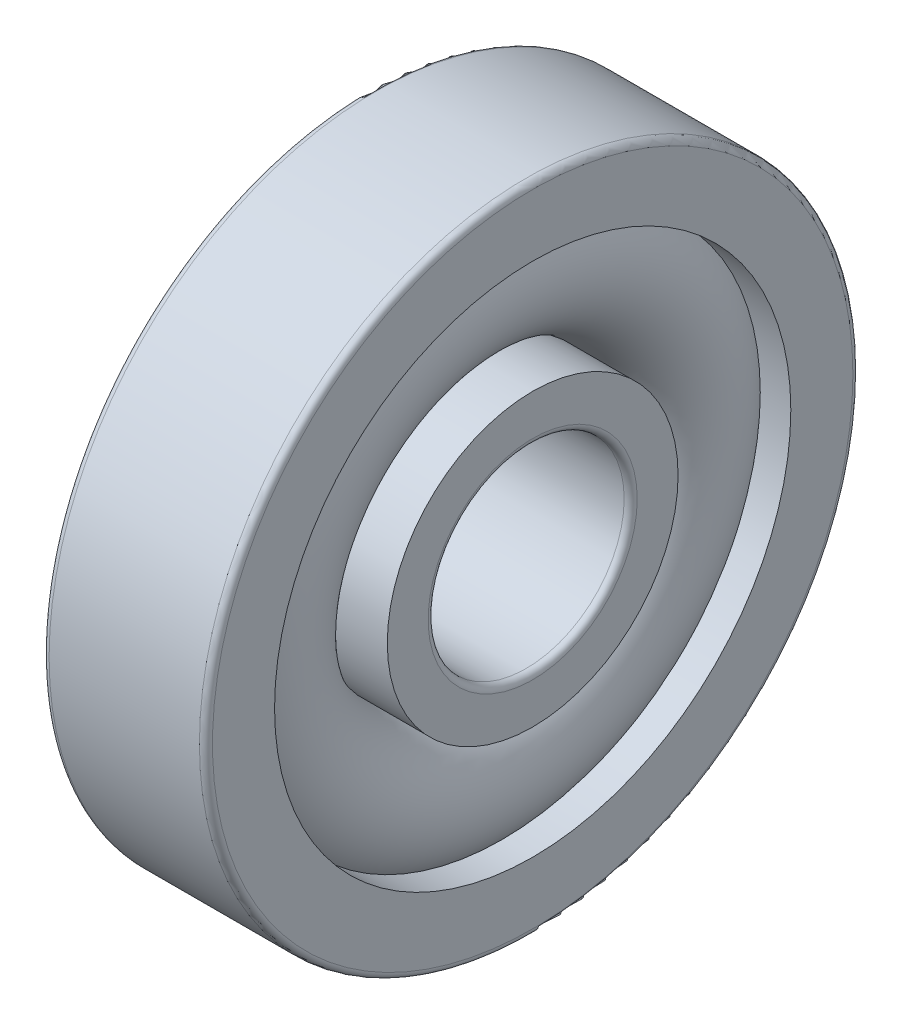
from build123d import *

# Parameters (mm, degrees)
CAGSPISKE_W     = 0.525
CAGSPISKE_H     = 0.35
CAGESPINE_ANGLE = 0.001
BALSIMSKE_R     = 1.05


with BuildPart() as part:
    # CagSpiSke → CageSpine (revolve)
    with BuildSketch(Plane.XY):
        with Locations((0, 3.25)):
            Rectangle(CAGSPISKE_W, CAGSPISKE_H)
    revolve(axis=Axis((-20.6375, 0, 0), (1, 0, 0)), revolution_arc=CAGESPINE_ANGLE)

    # BalSimSke → BallsSimplified (revolve)
    with BuildSketch(Plane.XY):
        with Locations((0, 3.25)):
            Circle(BALSIMSKE_R)
    revolve(axis=Axis((-10, 0, 0), (1, 0, 0)))

    # InnRacSke → InnerRace (revolve)
    with BuildSketch(Plane.XY):
        with BuildLine():
            Line((-0.748748957, 2.55), (-1.25, 2.55))
            Line((-1.25, 2.55), (-1.25, 1.6))
            ThreePointArc((-1.25, 1.6), (-1.220710678, 1.529289322), (-1.15, 1.5))
            Line((-1.15, 1.5), (1.15, 1.5))
            ThreePointArc((1.15, 1.5), (1.220710678, 1.529289322), (1.25, 1.6))
            Line((1.25, 1.6), (1.25, 2.225))
            Line((1.25, 2.225), (0, 2.225))
            ThreePointArc((0, 2.225), (-0.408120693, 2.309754022), (-0.748748957, 2.55))
        make_face()
    revolve(axis=Axis((-20.6375, 0, 0), (1, 0, 0)))

    # OutRacSke → OuterRace (revolve)
    with BuildSketch(Plane.XY):
        with BuildLine():
            Line((0, 4.275), (-1.25, 4.275))
            Line((-1.25, 4.275), (-1.25, 4.9))
            ThreePointArc((-1.25, 4.9), (-1.220710678, 4.970710678), (-1.15, 5))
            Line((-1.15, 5), (1.15, 5))
            ThreePointArc((1.15, 5), (1.220710678, 4.970710678), (1.25, 4.9))
            Line((1.25, 4.9), (1.25, 3.95))
            Line((1.25, 3.95), (0.748748957, 3.95))
            ThreePointArc((0.748748957, 3.95), (0.408120693, 4.190245978), (0, 4.275))
        make_face()
    revolve(axis=Axis((-20.6375, 0, 0), (1, 0, 0)))


solid = part.part
